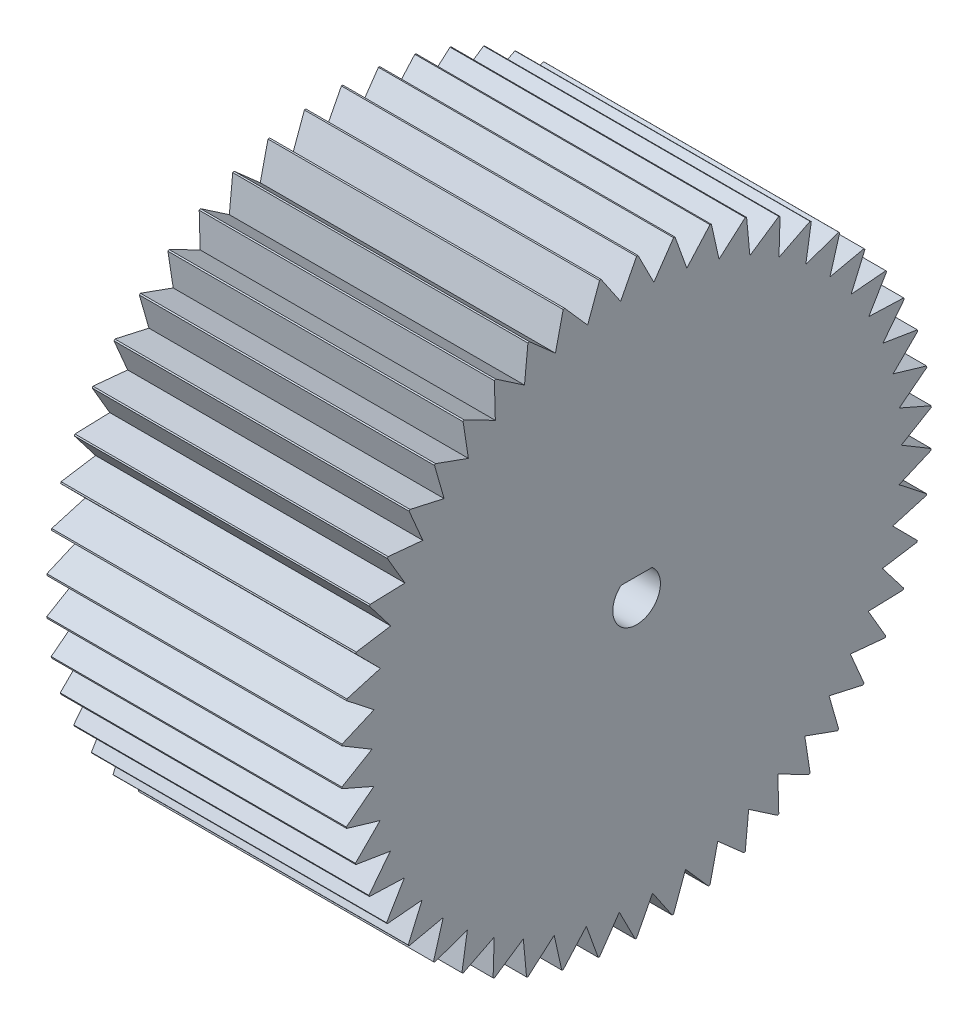
from build123d import *

# Parameters (mm, degrees)
BOSS_EXTRUDE1_DEPTH = 25.4


with BuildPart() as part:
    # Sketch1 → Boss-Extrude1 (new body)
    with BuildSketch(Plane(origin=(0, 0, 0), x_dir=(0, 0, -1), z_dir=(1, 0, 0))):
        with BuildLine():
            Line((-3.058165342, 25.21522605), (-1.373518571, 22.73289544))
            Line((-1.373518571, 22.73289544), (0, 25.4))
            ThreePointArc((0, 25.4), (0.063127705, 25.399921553), (0.126255021, 25.399686212))
            Line((0.126255021, 25.399686212), (1.486499327, 22.725787293))
            Line((1.486499327, 22.725787293), (3.183464133, 25.199713413))
            ThreePointArc((3.183464133, 25.199713413), (3.246084225, 25.191723585), (3.308684267, 25.18357815))
            Line((3.308684267, 25.18357815), (4.323074242, 22.360279905))
            Line((4.323074242, 22.360279905), (6.316723134, 24.602012293))
            ThreePointArc((6.316723134, 24.602012293), (6.377848057, 24.586237088), (6.438933585, 24.570310016))
            Line((6.438933585, 24.570310016), (7.091471695, 21.642137546))
            Line((7.091471695, 21.642137546), (9.350363638, 23.616322742))
            ThreePointArc((9.350363638, 23.616322742), (9.409029416, 23.593010945), (9.467637075, 23.569553416))
            Line((9.467637075, 23.569553416), (9.748032402, 20.582685749))
            Line((9.748032402, 20.582685749), (12.236543322, 22.258189673))
            ThreePointArc((12.236543322, 22.258189673), (12.29182476, 22.227708925), (12.347030272, 22.197090879))
            Line((12.347030272, 22.197090879), (12.250860815, 19.198632702))
            Line((12.250860815, 19.198632702), (14.929745408, 20.549031657))
            ThreePointArc((14.929745408, 20.549031657), (14.980770685, 20.511862658), (15.031703426, 20.474566958))
            Line((15.031703426, 20.474566958), (14.560485835, 17.511805749))
            Line((14.560485835, 17.511805749), (17.387496491, 18.515803137))
            ThreePointArc((17.387496491, 18.515803137), (17.433460907, 18.472532063), (17.479317637, 18.429146886))
            Line((17.479317637, 18.429146886), (16.640483295, 15.548807158))
            Line((16.640483295, 15.548807158), (19.571036367, 16.19056934))
            ThreePointArc((19.571036367, 16.19056934), (19.611215036, 16.141878603), (19.651272568, 16.093088158))
            Line((19.651272568, 16.093088158), (18.458050394, 13.34059459))
            Line((18.458050394, 13.34059459), (21.445929308, 13.610000592))
            ThreePointArc((21.445929308, 13.610000592), (21.479688589, 13.556658074), (21.513315191, 13.503231817))
            Line((21.513315191, 13.503231817), (19.984523011, 10.921992876))
            Line((19.984523011, 10.921992876), (22.982607133, 10.814794006))
            ThreePointArc((22.982607133, 10.814794006), (23.009414621, 10.757640949), (23.036079982, 10.700421443))
            Line((23.036079982, 10.700421443), (21.195827762, 8.33114481))
            Line((21.195827762, 8.33114481), (24.156835514, 7.849031657))
            ThreePointArc((24.156835514, 7.849031657), (24.17626844, 7.7889694), (24.195552031, 7.728859031))
            Line((24.195552031, 7.728859031), (22.072861647, 5.608909613))
            Line((22.072861647, 5.608909613), (24.950096169, 4.75948539))
            ThreePointArc((24.950096169, 4.75948539), (24.961848063, 4.697461151), (24.97344577, 4.635407895))
            Line((24.97344577, 4.635407895), (22.601793319, 2.798218561))
            Line((22.601793319, 2.798218561), (25.349878902, 1.594879196))
            ThreePointArc((25.349878902, 1.594879196), (25.353764431, 1.531871133), (25.357493352, 1.468853608))
            Line((25.357493352, 1.468853608), (22.774281208, -0.056602069))
            Line((22.774281208, -0.056602069), (25.349878902, -1.594879196))
            ThreePointArc((25.349878902, -1.594879196), (25.345836788, -1.657877407), (25.341638115, -1.720865378))
            Line((25.341638115, -1.720865378), (22.587605078, -2.910530051))
            Line((22.587605078, -2.910530051), (24.950096169, -4.75948539))
            ThreePointArc((24.950096169, -4.75948539), (24.938190159, -4.821480231), (24.926130107, -4.88344529))
            Line((24.926130107, -4.88344529), (22.044708923, -5.718557235))
            Line((22.044708923, -5.718557235), (24.156835514, -7.849031657))
            ThreePointArc((24.156835514, -7.849031657), (24.137253373, -7.909045431), (24.117522137, -7.969010351))
            Line((24.117522137, -7.969010351), (21.154154539, -8.436399355))
            Line((21.154154539, -8.436399355), (22.982607133, -10.814794006))
            ThreePointArc((22.982607133, -10.814794006), (22.955657682, -10.87188026), (22.928566436, -10.928899359))
            Line((22.928566436, -10.928899359), (19.929986501, -11.021194418))
            Line((19.929986501, -11.021194418), (21.445929308, -13.610000592))
            ThreePointArc((21.445929308, -13.610000592), (21.412037557, -13.663259043), (21.378013545, -13.716433096))
            Line((21.378013545, -13.716433096), (18.391510671, -13.432178662))
            Line((18.391510671, -13.432178662), (19.571036367, -16.19056934))
            ThreePointArc((19.571036367, -16.19056934), (19.530736808, -16.239160068), (19.49031661, -16.287650489))
            Line((19.49031661, -16.287650489), (16.56298973, -15.631329423))
            Line((16.56298973, -15.631329423), (17.387496491, -18.515803137))
            ThreePointArc((17.387496491, -18.515803137), (17.341424673, -18.558959839), (17.295245739, -18.602001904))
            Line((17.295245739, -18.602001904), (14.473260548, -17.583964782))
            Line((14.473260548, -17.583964782), (14.929745408, -20.549031657))
            ThreePointArc((14.929745408, -20.549031657), (14.878627912, -20.586073726), (14.827418511, -20.622988636))
            Line((14.827418511, -20.622988636), (12.1552794, -19.259290513))
            Line((12.1552794, -19.259290513), (12.236543322, -22.258189673))
            ThreePointArc((12.236543322, -22.258189673), (12.1811863, -22.288532933), (12.125754036, -22.318738519))
            Line((12.125754036, -22.318738519), (9.645602236, -20.630885727))
            Line((9.645602236, -20.630885727), (9.350363638, -23.616322742))
            ThreePointArc((9.350363638, -23.616322742), (9.291640104, -23.639488662), (9.232859176, -23.662508562))
            Line((9.232859176, -23.662508562), (6.983808161, -21.677119548))
            Line((6.983808161, -21.677119548), (6.316723134, -24.602012293))
            ThreePointArc((6.316723134, -24.602012293), (6.255559193, -24.617635532), (6.194356611, -24.63310671))
            Line((6.194356611, -24.63310671), (4.211875261, -22.381492245))
            Line((4.211875261, -22.381492245), (3.183464133, -25.199713413))
            ThreePointArc((3.183464133, -25.199713413), (3.120824376, -25.207547584), (3.058165342, -25.21522605))
            Line((3.058165342, -25.21522605), (1.373518571, -22.73289544))
            Line((1.373518571, -22.73289544), (0, -25.4))
            ThreePointArc((0, -25.4), (-0.063127705, -25.399921553), (-0.126255021, -25.399686212))
            Line((-0.126255021, -25.399686212), (-1.486499327, -22.725787293))
            Line((-1.486499327, -22.725787293), (-3.183464133, -25.199713413))
            ThreePointArc((-3.183464133, -25.199713413), (-3.246084225, -25.191723585), (-3.308684267, -25.18357815))
            Line((-3.308684267, -25.18357815), (-4.323074242, -22.360279905))
            Line((-4.323074242, -22.360279905), (-6.316723134, -24.602012293))
            ThreePointArc((-6.316723134, -24.602012293), (-6.377848057, -24.586237088), (-6.438933585, -24.570310016))
            Line((-6.438933585, -24.570310016), (-7.091471695, -21.642137546))
            Line((-7.091471695, -21.642137546), (-9.350363638, -23.616322742))
            ThreePointArc((-9.350363638, -23.616322742), (-9.409029416, -23.593010945), (-9.467637075, -23.569553416))
            Line((-9.467637075, -23.569553416), (-9.748032402, -20.582685749))
            Line((-9.748032402, -20.582685749), (-12.236543322, -22.258189673))
            ThreePointArc((-12.236543322, -22.258189673), (-12.29182476, -22.227708925), (-12.347030272, -22.197090879))
            Line((-12.347030272, -22.197090879), (-12.250860815, -19.198632702))
            Line((-12.250860815, -19.198632702), (-14.929745408, -20.549031657))
            ThreePointArc((-14.929745408, -20.549031657), (-14.980770685, -20.511862658), (-15.031703426, -20.474566958))
            Line((-15.031703426, -20.474566958), (-14.560485835, -17.511805749))
            Line((-14.560485835, -17.511805749), (-17.387496491, -18.515803137))
            ThreePointArc((-17.387496491, -18.515803137), (-17.433460907, -18.472532063), (-17.479317637, -18.429146886))
            Line((-17.479317637, -18.429146886), (-16.640483295, -15.548807158))
            Line((-16.640483295, -15.548807158), (-19.571036367, -16.19056934))
            ThreePointArc((-19.571036367, -16.19056934), (-19.611215036, -16.141878603), (-19.651272568, -16.093088158))
            Line((-19.651272568, -16.093088158), (-18.458050394, -13.34059459))
            Line((-18.458050394, -13.34059459), (-21.445929308, -13.610000592))
            ThreePointArc((-21.445929308, -13.610000592), (-21.479688589, -13.556658074), (-21.513315191, -13.503231817))
            Line((-21.513315191, -13.503231817), (-19.984523011, -10.921992876))
            Line((-19.984523011, -10.921992876), (-22.982607133, -10.814794006))
            ThreePointArc((-22.982607133, -10.814794006), (-23.009414621, -10.757640949), (-23.036079982, -10.700421443))
            Line((-23.036079982, -10.700421443), (-21.195827762, -8.33114481))
            Line((-21.195827762, -8.33114481), (-24.156835514, -7.849031657))
            ThreePointArc((-24.156835514, -7.849031657), (-24.17626844, -7.7889694), (-24.195552031, -7.728859031))
            Line((-24.195552031, -7.728859031), (-22.072861647, -5.608909613))
            Line((-22.072861647, -5.608909613), (-24.950096169, -4.75948539))
            ThreePointArc((-24.950096169, -4.75948539), (-24.961848063, -4.697461151), (-24.97344577, -4.635407895))
            Line((-24.97344577, -4.635407895), (-22.601793319, -2.798218561))
            Line((-22.601793319, -2.798218561), (-25.349878902, -1.594879196))
            ThreePointArc((-25.349878902, -1.594879196), (-25.353764431, -1.531871133), (-25.357493352, -1.468853608))
            Line((-25.357493352, -1.468853608), (-22.774281208, 0.056602069))
            Line((-22.774281208, 0.056602069), (-25.349878902, 1.594879196))
            ThreePointArc((-25.349878902, 1.594879196), (-25.345836788, 1.657877407), (-25.341638115, 1.720865378))
            Line((-25.341638115, 1.720865378), (-22.587605078, 2.910530051))
            Line((-22.587605078, 2.910530051), (-24.950096169, 4.75948539))
            ThreePointArc((-24.950096169, 4.75948539), (-24.938190159, 4.821480231), (-24.926130107, 4.88344529))
            Line((-24.926130107, 4.88344529), (-22.044708923, 5.718557235))
            Line((-22.044708923, 5.718557235), (-24.156835514, 7.849031657))
            ThreePointArc((-24.156835514, 7.849031657), (-24.137253373, 7.909045431), (-24.117522137, 7.969010351))
            Line((-24.117522137, 7.969010351), (-21.154154539, 8.436399355))
            Line((-21.154154539, 8.436399355), (-22.982607133, 10.814794006))
            ThreePointArc((-22.982607133, 10.814794006), (-22.955657682, 10.87188026), (-22.928566436, 10.928899359))
            Line((-22.928566436, 10.928899359), (-19.929986501, 11.021194418))
            Line((-19.929986501, 11.021194418), (-21.445929308, 13.610000592))
            ThreePointArc((-21.445929308, 13.610000592), (-21.412037557, 13.663259043), (-21.378013545, 13.716433096))
            Line((-21.378013545, 13.716433096), (-18.391510671, 13.432178662))
            Line((-18.391510671, 13.432178662), (-19.571036367, 16.19056934))
            ThreePointArc((-19.571036367, 16.19056934), (-19.530736808, 16.239160068), (-19.49031661, 16.287650489))
            Line((-19.49031661, 16.287650489), (-16.56298973, 15.631329423))
            Line((-16.56298973, 15.631329423), (-17.387496491, 18.515803137))
            ThreePointArc((-17.387496491, 18.515803137), (-17.341424673, 18.558959839), (-17.295245739, 18.602001904))
            Line((-17.295245739, 18.602001904), (-14.473260548, 17.583964782))
            Line((-14.473260548, 17.583964782), (-14.929745408, 20.549031657))
            ThreePointArc((-14.929745408, 20.549031657), (-14.878627912, 20.586073726), (-14.827418511, 20.622988636))
            Line((-14.827418511, 20.622988636), (-12.1552794, 19.259290513))
            Line((-12.1552794, 19.259290513), (-12.236543322, 22.258189673))
            ThreePointArc((-12.236543322, 22.258189673), (-12.1811863, 22.288532933), (-12.125754036, 22.318738519))
            Line((-12.125754036, 22.318738519), (-9.645602236, 20.630885727))
            Line((-9.645602236, 20.630885727), (-9.350363638, 23.616322742))
            ThreePointArc((-9.350363638, 23.616322742), (-9.291640104, 23.639488662), (-9.232859176, 23.662508562))
            Line((-9.232859176, 23.662508562), (-6.983808161, 21.677119548))
            Line((-6.983808161, 21.677119548), (-6.316723134, 24.602012293))
            ThreePointArc((-6.316723134, 24.602012293), (-6.255559193, 24.617635532), (-6.194356611, 24.63310671))
            Line((-6.194356611, 24.63310671), (-4.211875261, 22.381492245))
            Line((-4.211875261, 22.381492245), (-3.183464133, 25.199713413))
            ThreePointArc((-3.183464133, 25.199713413), (-3.120824376, 25.207547584), (-3.058165342, 25.21522605))
        make_face()
        with BuildLine():
            Line((-1.341640786, 1.55), (1.341640786, 1.55))
            ThreePointArc((1.341640786, 1.55), (0, -2.05), (-1.341640786, 1.55))
        make_face(mode=Mode.SUBTRACT)
    extrude(amount=BOSS_EXTRUDE1_DEPTH)


solid = part.part
